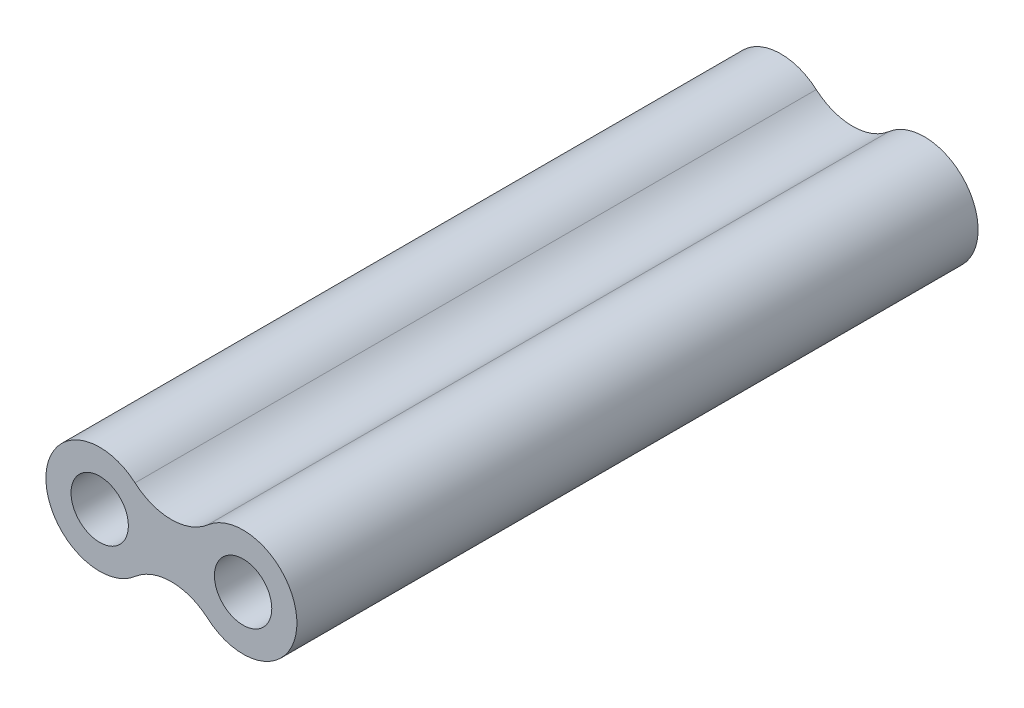
from build123d import *

# Parameters (mm, degrees)
SKETCH1_R                       = 3
BOSS_EXTRUDE1_DEPTH             = 19
M3_CLEARANCE_HOLE_D             = 3.2
BOSS_EXTRUDE2_REACH             = 21.468
BOSS_EXTRUDE2_DIRECTION_2_REACH = 21.468
M3_CLEARANCE_HOLE2_D            = 3.2


with BuildPart() as part:
    # Sketch1 → Boss-Extrude1 (new, symmetric)
    with BuildSketch(Plane.XY):
        Circle(SKETCH1_R)
    extrude(amount=BOSS_EXTRUDE1_DEPTH, both=True)

    # M3 Clearance Hole (through all)
    with Locations(Plane.XY.offset(19)):
        with Locations((0, 0)):
            Hole(M3_CLEARANCE_HOLE_D / 2)

    # Boss-Extrude2: up to this face of the body (flat: up to its plane)
    boss_extrude2_end = Plane(part.part.faces().sort_by_distance((-2.915147186, 0, 19))[0])
    # Sketch2 → Boss-Extrude2 (add, up to the picked face)
    with BuildSketch(Plane.XY, mode=Mode.PRIVATE) as boss_extrude2_sk1:
        with BuildLine():
            ThreePointArc((6.02739726, -2.260273973), (11, 0), (6.02739726, 2.260273973))
            ThreePointArc((6.02739726, 2.260273973), (4, 1.5), (1.97260274, 2.260273973))
            ThreePointArc((1.97260274, 2.260273973), (3, 0), (1.97260274, -2.260273973))
            ThreePointArc((1.97260274, -2.260273973), (4, -1.5), (6.02739726, -2.260273973))
        make_face()
    boss_extrude2_tool1 = split(extrude(boss_extrude2_sk1.sketch, amount=BOSS_EXTRUDE2_REACH, mode=Mode.PRIVATE), bisect_by=boss_extrude2_end, keep=Keep.BOTH, mode=Mode.PRIVATE)
    add(boss_extrude2_tool1.solids().sort_by(Axis((7.146911, 0, 0), (0, 0, 1)))[0])

    # Boss-Extrude2 direction 2: up to this face of the body (flat: up to its plane)
    boss_extrude2_direction_2_end = Plane(part.part.faces().sort_by_distance((-2.915147186, 0, -19))[0])
    # Sketch2 → Boss-Extrude2 direction 2 (add, up to the picked face)
    with BuildSketch(Plane.XY, mode=Mode.PRIVATE) as boss_extrude2_direction_2_sk1:
        with BuildLine():
            ThreePointArc((6.02739726, -2.260273973), (11, 0), (6.02739726, 2.260273973))
            ThreePointArc((6.02739726, 2.260273973), (4, 1.5), (1.97260274, 2.260273973))
            ThreePointArc((1.97260274, 2.260273973), (3, 0), (1.97260274, -2.260273973))
            ThreePointArc((1.97260274, -2.260273973), (4, -1.5), (6.02739726, -2.260273973))
        make_face()
    boss_extrude2_direction_2_tool1 = split(extrude(boss_extrude2_direction_2_sk1.sketch, amount=-BOSS_EXTRUDE2_DIRECTION_2_REACH, mode=Mode.PRIVATE), bisect_by=boss_extrude2_direction_2_end, keep=Keep.BOTH, mode=Mode.PRIVATE)
    add(boss_extrude2_direction_2_tool1.solids().sort_by(Axis((7.146911, 0, 0), (0, 0, -1)))[0])

    # M3 Clearance Hole2 (through all)
    with Locations(Plane.XY.offset(19)):
        with Locations((8, 0)):
            Hole(M3_CLEARANCE_HOLE2_D / 2)


solid = part.part
